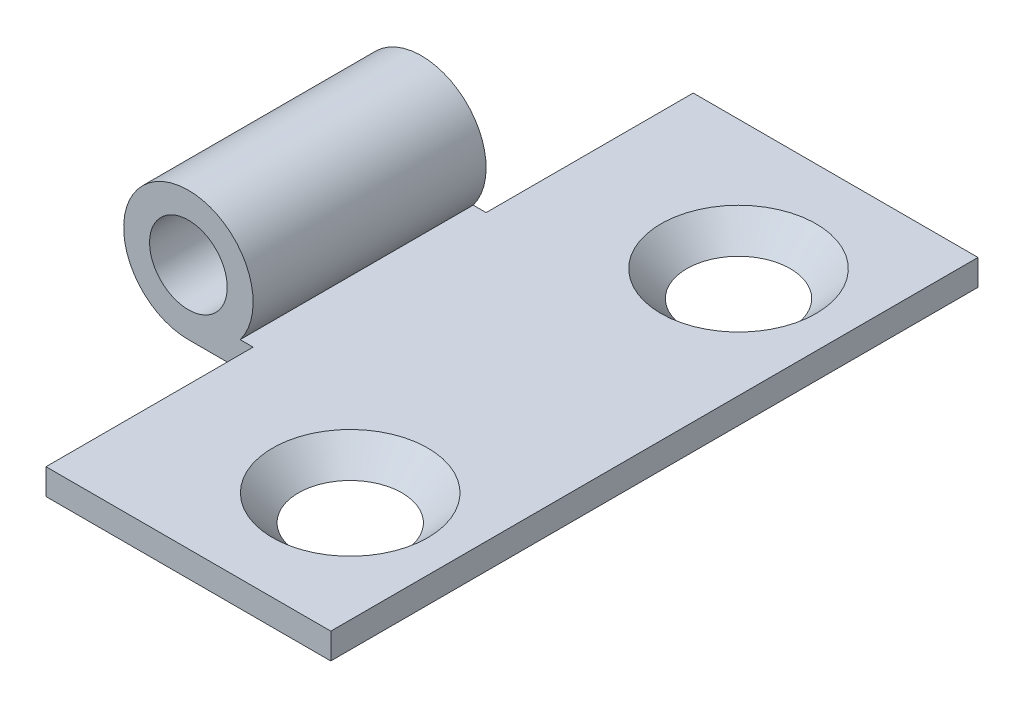
from build123d import *

# Parameters (mm, degrees)
SKETCH_1_R          = 1.5
EXTRUDE_1_DEPTH     = 25
SKETCH_2_R          = 2
SKETCH_2_W          = 5
SKETCH_2_H          = 8
CUT_EXTRUDE_1_DEPTH = 29.848743474
CHAMFER_1_SIZE      = 1


with BuildPart() as part:
    # 草图1 → 凸台-拉伸1 (new body)
    with BuildSketch(Plane.XY):
        with BuildLine():
            Line((0, -2.5), (13.5, -2.5))
            Line((13.5, -2.5), (13.5, -1.5))
            Line((13.5, -1.5), (2, -1.5))
            ThreePointArc((2, -1.5), (-1.118033989, 2.236067977), (0, -2.5))
        make_face()
        Circle(SKETCH_1_R, mode=Mode.SUBTRACT)
    extrude(amount=EXTRUDE_1_DEPTH)

    # 草图2 → 切除-拉伸1 (cut, through all)
    with BuildSketch(Plane.XZ.offset(2.5)):
        with Locations(Location((9.25, 20, 0), (0, 0, 270))):
            Circle(SKETCH_2_R)
        with Locations((9.25, 5)):
            Circle(SKETCH_2_R)
        with Locations((0, 4)):
            Rectangle(SKETCH_2_W, SKETCH_2_H)
        with Locations((0, 21)):
            Rectangle(SKETCH_2_W, SKETCH_2_H)
    extrude(amount=-CUT_EXTRUDE_1_DEPTH, mode=Mode.SUBTRACT)

    # 倒角1
    chamfer_1_edges = [part.edges().sort_by_distance(p)[0] for p in [
        (7.25, -1.5, 5),
        (9.25, -1.5, 22),
    ]]
    chamfer(chamfer_1_edges, length=CHAMFER_1_SIZE - 0.0001)  # a hair under: the kernel refuses the full size


solid = part.part
